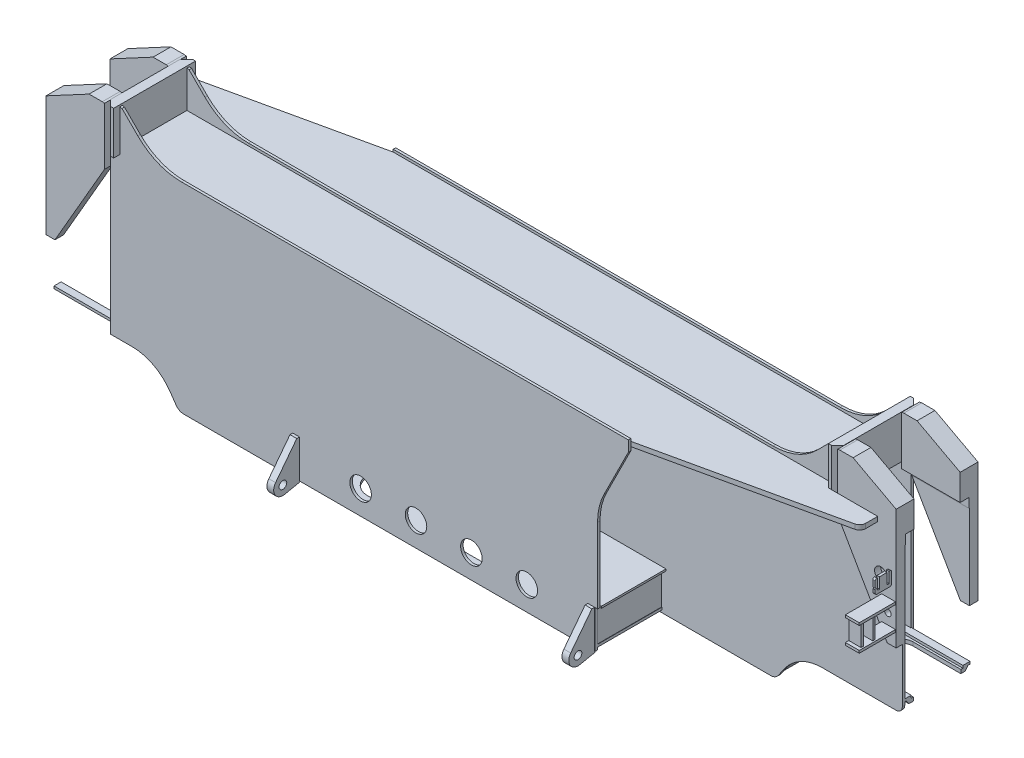
from build123d import *

# Parameters (mm, degrees)
EXTRUDE_1_DEPTH      = 8
SKETCH_4_R           = 35
CUT_EXTRUDE_2_DEPTH  = 8
EXTRUDE_2_DEPTH      = 8
SKETCH_8_R           = 35
CUT_EXTRUDE_4_DEPTH  = 8
EXTRUDE_3_DEPTH      = 8
SKETCH_12_R          = 35
CUT_EXTRUDE_6_DEPTH  = 8
EXTRUDE_4_DEPTH      = 15
EXTRUDE_5_DEPTH      = 15
SKETCH_17_W          = 1317.5
SKETCH_17_H          = 210
EXTRUDE_6_DEPTH      = 8
SKETCH_19_R          = 60
CUT_EXTRUDE_8_DEPTH  = 8
SKETCH_20_W          = 1317.5
SKETCH_20_H          = 210
EXTRUDE_7_DEPTH      = 8
SKETCH_21_R          = 60
CUT_EXTRUDE_9_DEPTH  = 8
EXTRUDE_8_DEPTH      = 319
EXTRUDE_9_DEPTH      = 319
EXTRUDE_10_DEPTH     = 319
EXTRUDE_11_DEPTH     = 319
SKETCH_29_W          = 944
SKETCH_29_H          = 210
EXTRUDE_12_DEPTH     = 6
SKETCH_30_W          = 944
SKETCH_30_H          = 210
EXTRUDE_13_DEPTH     = 6
SKETCH_32_W          = 214
SKETCH_32_H          = 116
EXTRUDE_14_DEPTH     = 19
SKETCH_34_R          = 30
CUT_EXTRUDE_11_DEPTH = 19
SKETCH_36_W          = 214
SKETCH_36_H          = 116
EXTRUDE_15_DEPTH     = 19
SKETCH_38_R          = 30
CUT_EXTRUDE_13_DEPTH = 19
EXTRUDE_16_DEPTH     = 20
EXTRUDE_17_DEPTH     = 20
EXTRUDE_18_DEPTH     = 20
EXTRUDE_19_DEPTH     = 20
SKETCH_47_R          = 20.25
SKETCH_47_R_2        = 10.5
CUT_EXTRUDE_15_DEPTH = 20
SKETCH_49_R          = 20.25
SKETCH_49_R_2        = 10.5
CUT_EXTRUDE_17_DEPTH = 20
EXTRUDE_20_DEPTH     = 8
EXTRUDE_21_DEPTH     = 8
EXTRUDE_22_DEPTH     = 25
EXTRUDE_23_DEPTH     = 25
EXTRUDE_24_DEPTH     = 25
EXTRUDE_25_DEPTH     = 25
EXTRUDE_26_DEPTH     = 7
EXTRUDE_27_DEPTH     = 4
EXTRUDE_28_DEPTH     = 7
EXTRUDE_29_DEPTH     = 4
EXTRUDE_30_DEPTH     = 7
EXTRUDE_31_DEPTH     = 4
EXTRUDE_32_DEPTH     = 7
EXTRUDE_33_DEPTH     = 4
EXTRUDE_34_DEPTH     = 833
CUT_EXTRUDE_19_DEPTH = 12
EXTRUDE_35_DEPTH     = 833
CUT_EXTRUDE_20_DEPTH = 12
EXTRUDE_36_DEPTH     = 8
EXTRUDE_37_DEPTH     = 8
SKETCH_84_W          = 214
SKETCH_84_H          = 109
EXTRUDE_38_DEPTH     = 22
SKETCH_86_R          = 12.5
CUT_EXTRUDE_22_DEPTH = 22
SKETCH_88_W          = 214
SKETCH_88_H          = 109
EXTRUDE_39_DEPTH     = 22
SKETCH_90_R          = 12.5
CUT_EXTRUDE_24_DEPTH = 22
SKETCH_92_W          = 118
SKETCH_92_H          = 8
EXTRUDE_40_DEPTH     = 45
SKETCH_94_W          = 8
SKETCH_94_H          = 70
EXTRUDE_41_DEPTH     = 40
SKETCH_96_W          = 118
SKETCH_96_H          = 8
EXTRUDE_42_DEPTH     = 45
SKETCH_97_W          = 8
SKETCH_97_H          = 70
EXTRUDE_43_DEPTH     = 40
EXTRUDE_44_DEPTH     = 8
SKETCH_101_W         = 7
SKETCH_101_H         = 42
CUT_EXTRUDE_26_DEPTH = 8
SKETCH_102_R         = 2.5
CUT_EXTRUDE_27_DEPTH = 8
EXTRUDE_45_DEPTH     = 8
SKETCH_106_W         = 7
SKETCH_106_H         = 42
CUT_EXTRUDE_29_DEPTH = 8
SKETCH_107_R         = 2.5
CUT_EXTRUDE_30_DEPTH = 8
EXTRUDE_46_DEPTH     = 140
EXTRUDE_47_DEPTH     = 140
EXTRUDE_48_DEPTH     = 188
EXTRUDE_49_DEPTH     = 188


with BuildPart() as part:
    # ｽｹｯﾁ2 → ﾎﾞｽ - 押し出し1 (new body)
    with BuildSketch(Plane.XY.offset(238)):
        with BuildLine():
            Line((20, 120), (259.781, 119.999840908))
            ThreePointArc((259.781, 119.999840908), (329.136433358, 103.002917773), (382.774130448, 55.864091069))
            Line((382.774130448, 55.864091069), (403.045155312, 26.827108426))
            ThreePointArc((403.045155312, 26.827108426), (413.772782228, 17.399235302), (427.644, 13.999810585))
            Line((427.644, 13.999810585), (2117.356, 13.999810585))
            ThreePointArc((2117.356, 13.999810585), (2131.227217772, 17.399235302), (2141.954844688, 26.827108426))
            Line((2141.954844688, 26.827108426), (2162.225869552, 55.864091069))
            ThreePointArc((2162.225869552, 55.864091069), (2215.863566642, 103.002917773), (2285.219, 119.999840908))
            Line((2285.219, 119.999840908), (2525, 120))
            ThreePointArc((2525, 120), (2539.142135624, 125.857864376), (2545, 140))
            Line((2545, 140), (2545, 315.36))
            Line((2545, 315.36), (2545, 706))
            Line((2545, 706), (2405, 781))
            Line((2405, 781), (2362, 781))
            Line((2362, 781), (2318, 774))
            Line((2318, 774), (2266.578928118, 722.579071882))
            ThreePointArc((2266.578928118, 722.579071882), (2201.694052016, 679.224134879), (2125.157, 663.999898344))
            Line((2125.157, 663.999898344), (419.843, 663.999898344))
            ThreePointArc((419.843, 663.999898344), (343.305947984, 679.224134879), (278.421071882, 722.579071882))
            Line((278.421071882, 722.579071882), (227, 774))
            Line((227, 774), (183, 781))
            Line((183, 781), (140, 781))
            Line((140, 781), (0, 706))
            Line((0, 706), (0, 315.36))
            Line((0, 315.36), (0, 140))
            ThreePointArc((0, 140), (5.857864376, 125.857864376), (20, 120))
        make_face()
    extrude(amount=EXTRUDE_1_DEPTH)

    # ｽｹｯﾁ4 → ｶｯﾄ - 押し出し2 (cut)
    with BuildSketch(Plane.XY.offset(238)):
        with Locations((972.5, 92)):
            Circle(SKETCH_4_R)
        with Locations((1272.5, 92)):
            Circle(SKETCH_4_R)
        with Locations((1572.5, 92)):
            Circle(SKETCH_4_R)
        with BuildLine():
            Line((1072.5, 297), (1472.5, 297))
            ThreePointArc((1472.5, 297), (1543.210678119, 326.289321881), (1572.5, 397))
            ThreePointArc((1572.5, 397), (1543.210678119, 467.710678119), (1472.5, 497))
            Line((1472.5, 497), (1072.5, 497))
            ThreePointArc((1072.5, 497), (1001.789321881, 467.710678119), (972.5, 397))
            ThreePointArc((972.5, 397), (1001.789321881, 326.289321881), (1072.5, 297))
        make_face()
    extrude(amount=CUT_EXTRUDE_2_DEPTH, mode=Mode.SUBTRACT)



with BuildPart() as body_2:
    # ｽｹｯﾁ6 → ﾎﾞｽ - 押し出し2 (new body)
    with BuildSketch(Plane.XY.offset(20)):
        with BuildLine():
            Line((781, 14), (2117.356, 13.999810585))
            ThreePointArc((2117.356, 13.999810585), (2131.227217772, 17.399235302), (2141.954844688, 26.827108426))
            Line((2141.954844688, 26.827108426), (2162.225869552, 55.864091069))
            ThreePointArc((2162.225869552, 55.864091069), (2215.863566642, 103.002917773), (2285.219, 119.999840908))
            Line((2285.219, 119.999840908), (2355, 120))
            Line((2355, 120), (2355, 779.886363636))
            Line((2355, 779.886363636), (2318, 774))
            Line((2318, 774), (2266.578928118, 722.579071882))
            ThreePointArc((2266.578928118, 722.579071882), (2201.694052016, 679.224134879), (2125.157, 663.999898344))
            Line((2125.157, 663.999898344), (672.5, 664))
            Line((672.5, 664), (672.5, 629))
            Line((672.5, 629), (751.3851191, 471.22905955))
            ThreePointArc((751.3851191, 471.22905955), (767.149616924, 427.736771141), (772.499866842, 381.786))
            Line((772.499866842, 381.786), (772.5, 138))
            Line((772.5, 138), (781, 138))
            Line((781, 138), (781, 14))
        make_face()
    extrude(amount=EXTRUDE_2_DEPTH)

    # ｽｹｯﾁ8 → ｶｯﾄ - 押し出し4 (cut)
    with BuildSketch(Plane.XY.offset(20)):
        with Locations((1002.5, 92)):
            Circle(SKETCH_8_R)
        with Locations((1182.5, 92)):
            Circle(SKETCH_8_R)
        with Locations((1362.5, 92)):
            Circle(SKETCH_8_R)
        with Locations((1542.5, 92)):
            Circle(SKETCH_8_R)
    extrude(amount=CUT_EXTRUDE_4_DEPTH, mode=Mode.SUBTRACT)


with BuildPart() as body_3:
    # ｽｹｯﾁ10 → ﾎﾞｽ - 押し出し3 (new body)
    with BuildSketch(Plane.XY.offset(456)):
        with BuildLine():
            Line((1764, 14), (1764, 138))
            Line((1764, 138), (1772.5, 138))
            Line((1772.5, 138), (1772.500133158, 381.786))
            ThreePointArc((1772.500133158, 381.786), (1777.850383076, 427.736771141), (1793.6148809, 471.22905955))
            Line((1793.6148809, 471.22905955), (1872.5, 629))
            Line((1872.5, 629), (1872.5, 664))
            Line((1872.5, 664), (419.843, 663.999898344))
            ThreePointArc((419.843, 663.999898344), (343.305947984, 679.224134879), (278.421071882, 722.579071882))
            Line((278.421071882, 722.579071882), (227, 774))
            Line((227, 774), (190, 779.886363636))
            Line((190, 779.886363636), (190, 120))
            Line((190, 120), (259.781, 119.999840908))
            ThreePointArc((259.781, 119.999840908), (329.136433358, 103.002917773), (382.774130448, 55.864091069))
            Line((382.774130448, 55.864091069), (403.045155312, 26.827108426))
            ThreePointArc((403.045155312, 26.827108426), (413.772782228, 17.399235302), (427.644, 13.999810585))
            Line((427.644, 13.999810585), (1764, 14))
        make_face()
    extrude(amount=EXTRUDE_3_DEPTH)

    # ｽｹｯﾁ12 → ｶｯﾄ - 押し出し6 (cut)
    with BuildSketch(Plane.XY.offset(456)):
        with Locations((1002.5, 92)):
            Circle(SKETCH_12_R)
        with Locations((1182.5, 92)):
            Circle(SKETCH_12_R)
        with Locations((1362.5, 92)):
            Circle(SKETCH_12_R)
        with Locations((1542.5, 92)):
            Circle(SKETCH_12_R)
    extrude(amount=CUT_EXTRUDE_6_DEPTH, mode=Mode.SUBTRACT)


with BuildPart() as part_1:
    add(part.part)

    add(body_2.part)  # ﾎﾞｽ - 押し出し4 merges body 2
    # ｽｹｯﾁ14 → ﾎﾞｽ - 押し出し4 (add)
    with BuildSketch(Plane(origin=(0, 641, 0), x_dir=(1, 0, 0), z_dir=(0, 1, 0))):
        with BuildLine():
            Line((672.5, -28), (75.720556621, -159.532541471))
            ThreePointArc((75.720556621, -159.532541471), (64.416289327, -166.53198258), (59.997398288, -179.072))
            Line((59.997398288, -179.072), (60, -218))
            Line((60, -218), (220, -218))
            Line((220, -218), (220, -238))
            Line((220, -238), (2324.98, -238))
            Line((2324.98, -238), (2324.98, -28))
            Line((2324.98, -28), (672.5, -28))
        make_face()
    extrude(amount=EXTRUDE_4_DEPTH)


    add(body_3.part)  # ﾎﾞｽ - 押し出し5 merges body 3
    # ｽｹｯﾁ15 → ﾎﾞｽ - 押し出し5 (add)
    with BuildSketch(Plane(origin=(0, 641, 0), x_dir=(1, 0, 0), z_dir=(0, 1, 0))):
        with BuildLine():
            Line((1872.5, -456), (2469.279443379, -324.467458529))
            ThreePointArc((2469.279443379, -324.467458529), (2480.583710673, -317.46801742), (2485.002601712, -304.928))
            Line((2485.002601712, -304.928), (2485, -266))
            Line((2485, -266), (2325, -266))
            Line((2325, -266), (2325, -246))
            Line((2325, -246), (220.02, -246))
            Line((220.02, -246), (220.02, -456))
            Line((220.02, -456), (1872.5, -456))
        make_face()
    extrude(amount=EXTRUDE_5_DEPTH)

    # ｽｹｯﾁ17 → ﾎﾞｽ - 押し出し6 (add)
    with BuildSketch(Plane(origin=(0, 22, 0), x_dir=(1, 0, 0), z_dir=(0, 1, 0))):
        with Locations((1439.75, -133)):
            Rectangle(SKETCH_17_W, SKETCH_17_H)
    extrude(amount=EXTRUDE_6_DEPTH)

    # ｽｹｯﾁ19 → ｶｯﾄ - 押し出し8 (cut)
    with BuildSketch(Plane(origin=(0, 22, 0), x_dir=(1, 0, 0), z_dir=(0, 1, 0))):
        with Locations((972, -133)):
            Circle(SKETCH_19_R)
        with Locations((1572, -133)):
            Circle(SKETCH_19_R)
        with Locations((1942, -133)):
            Circle(SKETCH_19_R)
        with BuildLine():
            Line((1202, -73), (1342, -73))
            ThreePointArc((1342, -73), (1384.426406871, -90.573593129), (1402, -133))
            ThreePointArc((1402, -133), (1384.426406871, -175.426406871), (1342, -193))
            Line((1342, -193), (1202, -193))
            ThreePointArc((1202, -193), (1159.573593129, -175.426406871), (1142, -133))
            ThreePointArc((1142, -133), (1159.573593129, -90.573593129), (1202, -73))
        make_face()
    extrude(amount=CUT_EXTRUDE_8_DEPTH, mode=Mode.SUBTRACT)

    # ｽｹｯﾁ20 → ﾎﾞｽ - 押し出し7 (add)
    with BuildSketch(Plane(origin=(0, 22, 0), x_dir=(1, 0, 0), z_dir=(0, 1, 0))):
        with Locations((1105.25, -351)):
            Rectangle(SKETCH_20_W, SKETCH_20_H)
    extrude(amount=EXTRUDE_7_DEPTH)

    # ｽｹｯﾁ21 → ｶｯﾄ - 押し出し9 (cut)
    with BuildSketch(Plane(origin=(0, 22, 0), x_dir=(1, 0, 0), z_dir=(0, 1, 0))):
        with Locations((603, -351)):
            Circle(SKETCH_21_R)
        with Locations((973, -351)):
            Circle(SKETCH_21_R)
        with Locations((1573, -351)):
            Circle(SKETCH_21_R)
        with BuildLine():
            Line((1203, -291), (1343, -291))
            ThreePointArc((1343, -291), (1385.426406871, -308.573593129), (1403, -351))
            ThreePointArc((1403, -351), (1385.426406871, -393.426406871), (1343, -411))
            Line((1343, -411), (1203, -411))
            ThreePointArc((1203, -411), (1160.573593129, -393.426406871), (1143, -351))
            ThreePointArc((1143, -351), (1160.573593129, -308.573593129), (1203, -291))
        make_face()
    extrude(amount=CUT_EXTRUDE_9_DEPTH, mode=Mode.SUBTRACT)

    # ｽｹｯﾁ23 → ﾎﾞｽ - 押し出し8 (add)
    with BuildSketch(Plane(origin=(1771.5, 0, 0), x_dir=(0, 0, -1), z_dir=(1, 0, 0))):
        Polygon((-27.763518519, 29), (-40.083691377, 28.97), (-63.75, 129.12), (-53.769954955, 137.8), (-53.492703704, 137.8), align=None)
    extrude(amount=EXTRUDE_8_DEPTH)

    # ｽｹｯﾁ24 → ﾎﾞｽ - 押し出し9 (add)
    with BuildSketch(Plane(origin=(1771.5, 0, 0), x_dir=(0, 0, -1), z_dir=(1, 0, 0))):
        Polygon((-212.507296296, 137.8), (-212.230045045, 137.8), (-202.25, 129.12), (-225.916308623, 28.97), (-238.236481481, 29), align=None)
    extrude(amount=EXTRUDE_9_DEPTH)

    # ｽｹｯﾁ26 → ﾎﾞｽ - 押し出し10 (add)
    with BuildSketch(Plane(origin=(454.5, 0, 0), x_dir=(0, 0, -1), z_dir=(1, 0, 0))):
        Polygon((-430.507296296, 137.8), (-430.230045045, 137.8), (-420.25, 129.12), (-443.916308623, 28.97), (-456.236481481, 29), align=None)
    extrude(amount=EXTRUDE_10_DEPTH)

    # ｽｹｯﾁ27 → ﾎﾞｽ - 押し出し11 (add)
    with BuildSketch(Plane(origin=(454.5, 0, 0), x_dir=(0, 0, -1), z_dir=(1, 0, 0))):
        Polygon((-245.763518519, 29), (-258.083691377, 28.97), (-281.75, 129.12), (-271.769954955, 137.8), (-271.492703704, 137.8), align=None)
    extrude(amount=EXTRUDE_11_DEPTH)

    # ｽｹｯﾁ29 → ﾎﾞｽ - 押し出し12 (add)
    with BuildSketch(Plane(origin=(0, 138, 0), x_dir=(1, 0, 0), z_dir=(0, 1, 0))):
        with Locations((1240, -133)):
            Rectangle(SKETCH_29_W, SKETCH_29_H)
    extrude(amount=EXTRUDE_12_DEPTH)

    # ｽｹｯﾁ30 → ﾎﾞｽ - 押し出し13 (add)
    with BuildSketch(Plane(origin=(0, 138, 0), x_dir=(1, 0, 0), z_dir=(0, 1, 0))):
        with Locations((1305, -351)):
            Rectangle(SKETCH_30_W, SKETCH_30_H)
    extrude(amount=EXTRUDE_13_DEPTH)

    # ｽｹｯﾁ32 → ﾎﾞｽ - 押し出し14 (add)
    with BuildSketch(Plane(origin=(427.5, 0, 0), x_dir=(0, 0, -1), z_dir=(1, 0, 0))):
        with Locations((-351, 80)):
            Rectangle(SKETCH_32_W, SKETCH_32_H)
    extrude(amount=EXTRUDE_14_DEPTH)

    # ｽｹｯﾁ34 → ｶｯﾄ - 押し出し11 (cut)
    with BuildSketch(Plane(origin=(427.5, 0, 0), x_dir=(0, 0, -1), z_dir=(1, 0, 0))):
        with Locations((-351, 80)):
            Circle(SKETCH_34_R)
    extrude(amount=CUT_EXTRUDE_11_DEPTH, mode=Mode.SUBTRACT)

    # ｽｹｯﾁ36 → ﾎﾞｽ - 押し出し15 (add)
    with BuildSketch(Plane(origin=(2098.5, 0, 0), x_dir=(0, 0, -1), z_dir=(1, 0, 0))):
        with Locations((-133, 80)):
            Rectangle(SKETCH_36_W, SKETCH_36_H)
    extrude(amount=EXTRUDE_15_DEPTH)

    # ｽｹｯﾁ38 → ｶｯﾄ - 押し出し13 (cut)
    with BuildSketch(Plane(origin=(2098.5, 0, 0), x_dir=(0, 0, -1), z_dir=(1, 0, 0))):
        with Locations((-133, 80)):
            Circle(SKETCH_38_R)
    extrude(amount=CUT_EXTRUDE_13_DEPTH, mode=Mode.SUBTRACT)

    # ｽｹｯﾁ40 → ﾎﾞｽ - 押し出し16 (add)
    with BuildSketch(Plane.XY.offset(218)):
        Polygon((0, 315.36), (29.105181683, 315.36), (190, 594.038), (190, 779.886363636), (183, 781), (140, 781), (0, 706), align=None)
    extrude(amount=EXTRUDE_16_DEPTH)

    # ｽｹｯﾁ45 → ﾎﾞｽ - 押し出し19 (add)
    with BuildSketch(Plane.XY.offset(246)):
        Polygon((2545, 315.36), (2545, 706), (2405, 781), (2362, 781), (2355, 779.886363636), (2355, 594.038), (2515.894818317, 315.36), align=None)
    extrude(amount=EXTRUDE_19_DEPTH)

    # ｽｹｯﾁ47 → ｶｯﾄ - 押し出し15 (cut)
    with BuildSketch(Plane.XY.offset(218)):
        with Locations((50, 499)):
            Circle(SKETCH_47_R)
        with Locations((27, 401.5)):
            Circle(SKETCH_47_R_2)
    extrude(amount=CUT_EXTRUDE_15_DEPTH, mode=Mode.SUBTRACT)

    # ｽｹｯﾁ49 → ｶｯﾄ - 押し出し17 (cut)
    with BuildSketch(Plane.XY.offset(246)):
        with Locations((2495, 499)):
            Circle(SKETCH_49_R)
        with Locations((2518, 401.5)):
            Circle(SKETCH_49_R_2)
    extrude(amount=CUT_EXTRUDE_17_DEPTH, mode=Mode.SUBTRACT)



with BuildPart() as body_2_2:
    # ｽｹｯﾁ42 → ﾎﾞｽ - 押し出し17 (new body)
    with BuildSketch(Plane.XY.offset(464)):
        Polygon((0, 315.36), (29.105181683, 315.36), (190, 594.038), (190, 779.886363636), (183, 781), (140, 781), (0, 706), align=None)
    extrude(amount=EXTRUDE_17_DEPTH)


with BuildPart() as body_3_2:
    # ｽｹｯﾁ43 → ﾎﾞｽ - 押し出し18 (new body)
    with BuildSketch(Plane.XY):
        Polygon((2545, 315.36), (2545, 706), (2405, 781), (2362, 781), (2355, 779.886363636), (2355, 594.038), (2515.894818317, 315.36), align=None)
    extrude(amount=EXTRUDE_18_DEPTH)


with BuildPart() as part_2:
    add(part_1.part)

    add(body_3_2.part)  # ﾎﾞｽ - 押し出し20 merges body 3 2
    # ｽｹｯﾁ50 → ﾎﾞｽ - 押し出し20 (add)
    with BuildSketch(Plane.XY.offset(20)):
        Polygon((2545, 315.36), (2545, 706), (2405, 781), (2362, 781), (2355, 779.886363636), (2355, 594.038), (2515.894818317, 315.36), align=None)
    extrude(amount=EXTRUDE_20_DEPTH)


    add(body_2_2.part)  # ﾎﾞｽ - 押し出し21 merges body 2 2
    # ｽｹｯﾁ51 → ﾎﾞｽ - 押し出し21 (add)
    with BuildSketch(Plane.XY.offset(456)):
        Polygon((0, 315.36), (29.105181683, 315.36), (190, 594.038), (190, 779.886363636), (183, 781), (140, 781), (0, 706), align=None)
    extrude(amount=EXTRUDE_21_DEPTH)



with BuildPart() as body_2_3:
    # ｽｹｯﾁ53 → ﾎﾞｽ - 押し出し22 (new body)
    with BuildSketch(Plane.XY.offset(251)):
        Polygon((0, 620.82), (190, 620.82), (190, 779.886363636), (183, 781), (140, 781), (0, 706), align=None)
    extrude(amount=EXTRUDE_22_DEPTH)


with BuildPart() as body_3_3:
    # ｽｹｯﾁ55 → ﾎﾞｽ - 押し出し23 (new body)
    with BuildSketch(Plane.XY.offset(426)):
        Polygon((0, 620.82), (190, 620.82), (190, 779.886363636), (183, 781), (140, 781), (0, 706), align=None)
    extrude(amount=EXTRUDE_23_DEPTH)


with BuildPart() as body_4:
    # ｽｹｯﾁ57 → ﾎﾞｽ - 押し出し24 (new body)
    with BuildSketch(Plane.XY.offset(33)):
        Polygon((2545, 620.82), (2545, 706), (2405, 781), (2362, 781), (2355, 779.886363636), (2355, 620.82), align=None)
    extrude(amount=EXTRUDE_24_DEPTH)


with BuildPart() as body_5:
    # ｽｹｯﾁ59 → ﾎﾞｽ - 押し出し25 (new body)
    with BuildSketch(Plane.XY.offset(208)):
        Polygon((2545, 620.82), (2545, 706), (2405, 781), (2362, 781), (2355, 779.886363636), (2355, 620.82), align=None)
    extrude(amount=EXTRUDE_25_DEPTH)


with BuildPart() as part_3:
    add(part_2.part)

    add(body_2_3.part)  # ﾎﾞｽ - 押し出し26 merges body 2 3
    # ｽｹｯﾁ61 → ﾎﾞｽ - 押し出し26 (add)
    with BuildSketch(Plane.XY.offset(244)):
        Polygon((0, 620.82), (190, 620.82), (190, 779.886363636), (183, 781), (140, 781), (0, 706), align=None)
    extrude(amount=EXTRUDE_26_DEPTH)

    # ｽｹｯﾁ62 → ﾎﾞｽ - 押し出し27 (add)
    with BuildSketch(Plane.XY.offset(244)):
        Polygon((0, 590.821), (188.142664184, 590.821), (190, 594.038), (190, 620.82), (0, 620.82), align=None)
    extrude(amount=EXTRUDE_27_DEPTH)


    add(body_3_3.part)  # ﾎﾞｽ - 押し出し28 merges body 3 3
    # ｽｹｯﾁ64 → ﾎﾞｽ - 押し出し28 (add)
    with BuildSketch(Plane.XY.offset(451)):
        Polygon((0, 620.82), (190, 620.82), (190, 779.886363636), (183, 781), (140, 781), (0, 706), align=None)
    extrude(amount=EXTRUDE_28_DEPTH)

    # ｽｹｯﾁ66 → ﾎﾞｽ - 押し出し29 (add)
    with BuildSketch(Plane.XY.offset(454)):
        Polygon((0, 590.821), (188.142664184, 590.821), (190, 594.038), (190, 620.82), (0, 620.82), align=None)
    extrude(amount=EXTRUDE_29_DEPTH)


    add(body_4.part)  # ﾎﾞｽ - 押し出し30 merges body 4
    # ｽｹｯﾁ68 → ﾎﾞｽ - 押し出し30 (add)
    with BuildSketch(Plane.XY.offset(26)):
        Polygon((2545, 620.82), (2545, 706), (2405, 781), (2362, 781), (2355, 779.886363636), (2355, 620.82), align=None)
    extrude(amount=EXTRUDE_30_DEPTH)

    # ｽｹｯﾁ69 → ﾎﾞｽ - 押し出し31 (add)
    with BuildSketch(Plane.XY.offset(26)):
        Polygon((2545, 590.821), (2545, 620.82), (2355, 620.82), (2355, 594.038), (2356.857335816, 590.821), align=None)
    extrude(amount=EXTRUDE_31_DEPTH)


    add(body_5.part)  # ﾎﾞｽ - 押し出し32 merges body 5
    # ｽｹｯﾁ71 → ﾎﾞｽ - 押し出し32 (add)
    with BuildSketch(Plane.XY.offset(233)):
        Polygon((2545, 620.82), (2545, 706), (2405, 781), (2362, 781), (2355, 779.886363636), (2355, 620.82), align=None)
    extrude(amount=EXTRUDE_32_DEPTH)

    # ｽｹｯﾁ73 → ﾎﾞｽ - 押し出し33 (add)
    with BuildSketch(Plane.XY.offset(236)):
        Polygon((2545, 590.821), (2545, 620.82), (2355, 620.82), (2355, 594.038), (2356.857335816, 590.821), align=None)
    extrude(amount=EXTRUDE_33_DEPTH)

    # ｽｹｯﾁ74 → ﾎﾞｽ - 押し出し34 (add)
    with BuildSketch(Plane(origin=(0, 0, 0), x_dir=(0, 0, -1), z_dir=(1, 0, 0))):
        Polygon((-251.6, 150), (-450.4, 150), (-450.4, 149), (-442.698, 138), (-259.302, 138), (-251.6, 149), align=None)
    extrude(amount=EXTRUDE_34_DEPTH)

    # ｽｹｯﾁ76 → ｶｯﾄ - 押し出し19 (cut)
    with BuildSketch(Plane(origin=(0, 138, 0), x_dir=(1, 0, 0), z_dir=(0, 1, 0))):
        with BuildLine():
            Line((-10, -273.771), (155, -273.771))
            ThreePointArc((155, -273.771), (183.284271247, -285.486728753), (195, -313.771))
            Line((195, -313.771), (195, -388.229))
            ThreePointArc((195, -388.229), (183.284271247, -416.513271247), (155, -428.229))
            Line((155, -428.229), (-10, -428.229))
            Line((-10, -428.229), (-10, -273.771))
        make_face()
    extrude(amount=CUT_EXTRUDE_19_DEPTH, mode=Mode.SUBTRACT)

    # ｽｹｯﾁ78 → ﾎﾞｽ - 押し出し35 (add)
    with BuildSketch(Plane(origin=(2545, 0, 0), x_dir=(0, 0, -1), z_dir=(1, 0, 0))):
        Polygon((-232.4, 150), (-232.4, 149), (-224.698, 138), (-41.302, 138), (-33.6, 149), (-33.6, 150), align=None)
    extrude(amount=-EXTRUDE_35_DEPTH)

    # ｽｹｯﾁ79 → ｶｯﾄ - 押し出し20 (cut)
    with BuildSketch(Plane(origin=(0, 138, 0), x_dir=(1, 0, 0), z_dir=(0, 1, 0))):
        with BuildLine():
            Line((2555, -210.229), (2390, -210.229))
            ThreePointArc((2390, -210.229), (2361.715728753, -198.513271247), (2350, -170.229))
            Line((2350, -170.229), (2350, -95.771))
            ThreePointArc((2350, -95.771), (2361.715728753, -67.486728753), (2390, -55.771))
            Line((2390, -55.771), (2555, -55.771))
            Line((2555, -55.771), (2555, -210.229))
        make_face()
    extrude(amount=CUT_EXTRUDE_20_DEPTH, mode=Mode.SUBTRACT)

    # ｽｹｯﾁ81 → ﾎﾞｽ - 押し出し36 (add)
    with BuildSketch(Plane(origin=(0, 150, 0), x_dir=(1, 0, 0), z_dir=(0, 1, 0))):
        Polygon((0, -244), (833, -244), (833, -291), (215.708, -291), (190, -267), (0, -267), align=None)
        Polygon((0, -458), (833, -458), (833, -411), (215.708, -411), (190, -435), (0, -435), align=None)
    extrude(amount=EXTRUDE_36_DEPTH)

    # ｽｹｯﾁ82 → ﾎﾞｽ - 押し出し37 (add)
    with BuildSketch(Plane(origin=(0, 150, 0), x_dir=(1, 0, 0), z_dir=(0, 1, 0))):
        Polygon((2545, -240), (1712, -240), (1712, -193), (2329.292, -193), (2355, -217), (2545, -217), align=None)
        Polygon((2545, -26), (1712, -26), (1712, -73), (2329.292, -73), (2355, -49), (2545, -49), align=None)
    extrude(amount=EXTRUDE_37_DEPTH)

    # ｽｹｯﾁ84 → ﾎﾞｽ - 押し出し38 (add)
    with BuildSketch(Plane(origin=(782, 0, 0), x_dir=(0, 0, -1), z_dir=(1, 0, 0))):
        with Locations((-133, 83.5)):
            Rectangle(SKETCH_84_W, SKETCH_84_H)
        with Locations((-351, 83.5)):
            Rectangle(SKETCH_84_W, SKETCH_84_H)
        with BuildLine():
            Line((-462, 10.779226811), (-512.018682535, 0.602315714))
            ThreePointArc((-512.018682535, 0.602315714), (-543.438180176, 14.097201839), (-541.807919751, 48.253299896))
            Line((-541.807919751, 48.253299896), (-473, 138))
            Line((-473, 138), (-462, 138))
            Line((-462, 138), (-462, 10.779226811))
        make_face()
    extrude(amount=EXTRUDE_38_DEPTH)

    # ｽｹｯﾁ86 → ｶｯﾄ - 押し出し22 (cut)
    with BuildSketch(Plane(origin=(782, 0, 0), x_dir=(0, 0, -1), z_dir=(1, 0, 0))):
        with Locations((-518, 30)):
            Circle(SKETCH_86_R)
    extrude(amount=CUT_EXTRUDE_22_DEPTH, mode=Mode.SUBTRACT)

    # ｽｹｯﾁ88 → ﾎﾞｽ - 押し出し39 (add)
    with BuildSketch(Plane(origin=(1741, 0, 0), x_dir=(0, 0, -1), z_dir=(1, 0, 0))):
        with Locations((-133, 83.5)):
            Rectangle(SKETCH_88_W, SKETCH_88_H)
        with Locations((-351, 83.5)):
            Rectangle(SKETCH_88_W, SKETCH_88_H)
        with BuildLine():
            Line((-462, 10.779226811), (-512.018682535, 0.602315714))
            ThreePointArc((-512.018682535, 0.602315714), (-543.438180176, 14.097201839), (-541.807919751, 48.253299896))
            Line((-541.807919751, 48.253299896), (-473, 138))
            Line((-473, 138), (-462, 138))
            Line((-462, 138), (-462, 10.779226811))
        make_face()
    extrude(amount=EXTRUDE_39_DEPTH)

    # ｽｹｯﾁ90 → ｶｯﾄ - 押し出し24 (cut)
    with BuildSketch(Plane(origin=(1741, 0, 0), x_dir=(0, 0, -1), z_dir=(1, 0, 0))):
        with Locations((-518, 30)):
            Circle(SKETCH_90_R)
    extrude(amount=CUT_EXTRUDE_24_DEPTH, mode=Mode.SUBTRACT)

    # ｽｹｯﾁ92 → ﾎﾞｽ - 押し出し40 (add)
    with BuildSketch(Plane(origin=(2, 0, 0), x_dir=(0, 0, -1), z_dir=(1, 0, 0))):
        with Locations((-159, 362.5)):
            Rectangle(SKETCH_92_W, SKETCH_92_H)
        with Locations((-159, 440.5)):
            Rectangle(SKETCH_92_W, SKETCH_92_H)
    extrude(amount=EXTRUDE_40_DEPTH)

    # ｽｹｯﾁ94 → ﾎﾞｽ - 押し出し41 (add)
    with BuildSketch(Plane(origin=(7, 0, 0), x_dir=(0, 0, -1), z_dir=(1, 0, 0))):
        with Locations((-115, 401.5)):
            Rectangle(SKETCH_94_W, SKETCH_94_H)
        with Locations((-153, 401.5)):
            Rectangle(SKETCH_94_W, SKETCH_94_H)
    extrude(amount=EXTRUDE_41_DEPTH)

    # ｽｹｯﾁ96 → ﾎﾞｽ - 押し出し42 (add)
    with BuildSketch(Plane(origin=(2498, 0, 0), x_dir=(0, 0, -1), z_dir=(1, 0, 0))):
        with Locations((-325, 362.5)):
            Rectangle(SKETCH_96_W, SKETCH_96_H)
        with Locations((-325, 440.5)):
            Rectangle(SKETCH_96_W, SKETCH_96_H)
    extrude(amount=EXTRUDE_42_DEPTH)

    # ｽｹｯﾁ97 → ﾎﾞｽ - 押し出し43 (add)
    with BuildSketch(Plane(origin=(2498, 0, 0), x_dir=(0, 0, -1), z_dir=(1, 0, 0))):
        with Locations((-369, 401.5)):
            Rectangle(SKETCH_97_W, SKETCH_97_H)
        with Locations((-331, 401.5)):
            Rectangle(SKETCH_97_W, SKETCH_97_H)
    extrude(amount=EXTRUDE_43_DEPTH)

    # ｽｹｯﾁ99 → ﾎﾞｽ - 押し出し44 (add)
    with BuildSketch(Plane(origin=(15, 0, 0), x_dir=(0, 0, -1), z_dir=(1, 0, 0))):
        with BuildLine():
            Line((-170, 483), (-213, 483))
            ThreePointArc((-213, 483), (-216.535533906, 484.464466094), (-218, 488))
            Line((-218, 488), (-218, 523))
            ThreePointArc((-218, 523), (-216.535533906, 526.535533906), (-213, 528))
            Line((-213, 528), (-170, 528))
            ThreePointArc((-170, 528), (-166.464466094, 526.535533906), (-165, 523))
            Line((-165, 523), (-165, 488))
            ThreePointArc((-165, 488), (-166.464466094, 484.464466094), (-170, 483))
        make_face()
    extrude(amount=EXTRUDE_44_DEPTH)

    # ｽｹｯﾁ101 → ｶｯﾄ - 押し出し26 (cut)
    with BuildSketch(Plane(origin=(15, 0, 0), x_dir=(0, 0, -1), z_dir=(1, 0, 0))):
        with Locations((-175.5, 514)):
            Rectangle(SKETCH_101_W, SKETCH_101_H)
        with Locations((-206.5, 514)):
            Rectangle(SKETCH_101_W, SKETCH_101_H)
    extrude(amount=CUT_EXTRUDE_26_DEPTH, mode=Mode.SUBTRACT)

    # ｽｹｯﾁ102 → ｶｯﾄ - 押し出し27 (cut)
    with BuildSketch(Plane(origin=(15, 0, 0), x_dir=(0, 0, -1), z_dir=(1, 0, 0))):
        with Locations((-166, 500)):
            Circle(SKETCH_102_R)
    extrude(amount=CUT_EXTRUDE_27_DEPTH, mode=Mode.SUBTRACT)

    # ｽｹｯﾁ104 → ﾎﾞｽ - 押し出し45 (add)
    with BuildSketch(Plane(origin=(2522, 0, 0), x_dir=(0, 0, -1), z_dir=(1, 0, 0))):
        with BuildLine():
            Line((-271, 483), (-314, 483))
            ThreePointArc((-314, 483), (-317.535533906, 484.464466094), (-319, 488))
            Line((-319, 488), (-319, 523))
            ThreePointArc((-319, 523), (-317.535533906, 526.535533906), (-314, 528))
            Line((-314, 528), (-271, 528))
            ThreePointArc((-271, 528), (-267.464466094, 526.535533906), (-266, 523))
            Line((-266, 523), (-266, 488))
            ThreePointArc((-266, 488), (-267.464466094, 484.464466094), (-271, 483))
        make_face()
    extrude(amount=EXTRUDE_45_DEPTH)

    # ｽｹｯﾁ106 → ｶｯﾄ - 押し出し29 (cut)
    with BuildSketch(Plane(origin=(2522, 0, 0), x_dir=(0, 0, -1), z_dir=(1, 0, 0))):
        with Locations((-308.5, 514)):
            Rectangle(SKETCH_106_W, SKETCH_106_H)
        with Locations((-277.5, 514)):
            Rectangle(SKETCH_106_W, SKETCH_106_H)
    extrude(amount=CUT_EXTRUDE_29_DEPTH, mode=Mode.SUBTRACT)

    # ｽｹｯﾁ107 → ｶｯﾄ - 押し出し30 (cut)
    with BuildSketch(Plane(origin=(2522, 0, 0), x_dir=(0, 0, -1), z_dir=(1, 0, 0))):
        with Locations((-318, 500)):
            Circle(SKETCH_107_R)
    extrude(amount=CUT_EXTRUDE_30_DEPTH, mode=Mode.SUBTRACT)

    # ｽｹｯﾁ108 → ﾎﾞｽ - 押し出し46 (add)
    with BuildSketch(Plane(origin=(0, 641, 0), x_dir=(1, 0, 0), z_dir=(0, 1, 0))):
        Polygon((190, -238), (210, -218), (220, -218), (220, -484), (210, -484), (190, -464), align=None)
    extrude(amount=EXTRUDE_46_DEPTH)

    # ｽｹｯﾁ109 → ﾎﾞｽ - 押し出し47 (add)
    with BuildSketch(Plane(origin=(0, 641, 0), x_dir=(1, 0, 0), z_dir=(0, 1, 0))):
        Polygon((2355, -246), (2335, -266), (2325, -266), (2325, 0), (2335, 0), (2355, -20), align=None)
    extrude(amount=EXTRUDE_47_DEPTH)

    # ｽｹｯﾁ111 → ﾎﾞｽ - 押し出し48 (add)
    with BuildSketch(Plane.XY.offset(257)):
        Polygon((412.153071341, 22.088564795), (421.982928659, 28.971435205), (344.940879281, 139), (330.291633079, 139), align=None)
    extrude(amount=EXTRUDE_48_DEPTH)

    # ｽｹｯﾁ113 → ｶｯﾄ - 回転1 (revolve, cut)
    with BuildSketch(Plane.XY.offset(351)):
        Polygon((359.909130586, 63.575686645), (400.866869414, 92.254313355), (377.923968046, 125.020504419), (336.966229217, 96.341877708), align=None)
    revolve(axis=Axis((359.909130586, 63.575686645, 351), (0.8191547765792332, 0.573572534216403, 0)), mode=Mode.SUBTRACT)

    # ｽｹｯﾁ115 → ﾎﾞｽ - 押し出し49 (add)
    with BuildSketch(Plane.XY.offset(39)):
        Polygon((2214.708366921, 139), (2200.059120719, 139), (2123.017071341, 28.971435205), (2132.846928659, 22.088564795), align=None)
    extrude(amount=EXTRUDE_49_DEPTH)

    # ｽｹｯﾁ117 → ｶｯﾄ - 回転2 (revolve, cut)
    with BuildSketch(Plane.XY.offset(133)):
        Polygon((2185.090869414, 63.575686645), (2144.133130586, 92.254313355), (2121.190229217, 59.488122292), (2162.147968046, 30.809495581), align=None)
    revolve(axis=Axis((2185.090869414, 63.575686645, 133), (-0.8191547765792335, 0.5735725342164025, 0)), mode=Mode.SUBTRACT)


solid = part_3.part
